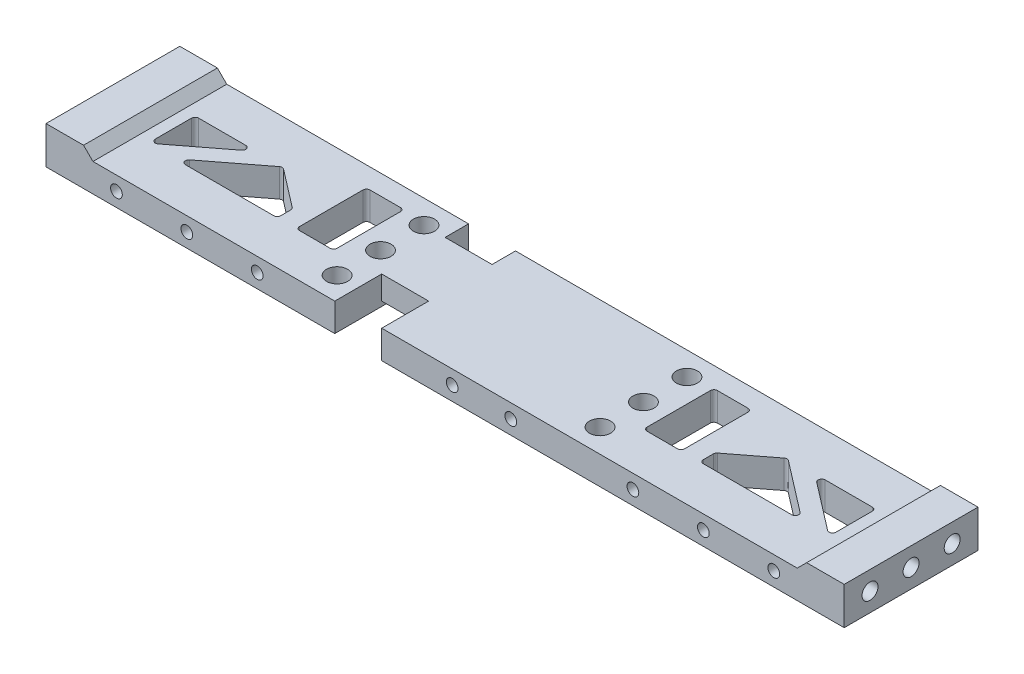
from build123d import *
from OCP.BRepFilletAPI import BRepFilletAPI_MakeChamfer

# Parameters (mm, degrees)
ESBO_O1_W                                           = 340
ESBO_O1_H                                           = 57
RESSALTO_EXTRUS_O1_DEPTH                            = 12
ESBO_O2_W                                           = 20
ESBO_O2_H                                           = 57
RESSALTO_EXTRUS_O2_DEPTH                            = 4
BROCA_DE_ROSQUEAR_PARA_TARRAXA_DE_M81_D             = 6.8
BROCA_DE_ROSQUEAR_PARA_TARRAXA_DE_M81_DEPTH         = 15
BROCA_DE_ROSQUEAR_PARA_TARRAXA_DE_M81_TIP           = 2.042926105
BROCA_DE_ROSQUEAR_PARA_TARRAXA_DE_M82_D             = 6.8
BROCA_DE_ROSQUEAR_PARA_TARRAXA_DE_M82_DEPTH         = 15
BROCA_DE_ROSQUEAR_PARA_TARRAXA_DE_M82_TIP           = 2.042926105
ESBO_O7_W                                           = 20
ESBO_O7_H                                           = 10
ESBO_O7_H_2                                         = 20
CORTE_EXTRUS_O1_DEPTH                               = 345.953620071
CHANFRO1_SIZE                                       = 2
CHANFRO1_SIZE2                                      = 3.464101615
CHANFRO3_SIZE                                       = 4
BROCA_DE_ROSQUEAR_PARA_TARRAXA_DE_M61_D             = 5
BROCA_DE_ROSQUEAR_PARA_TARRAXA_DE_M61_DEPTH         = 15
BROCA_DE_ROSQUEAR_PARA_TARRAXA_DE_M61_TIP           = 1.502151548
BROCA_DE_ROSQUEAR_PARA_TARRAXA_DE_M62_D             = 5
BROCA_DE_ROSQUEAR_PARA_TARRAXA_DE_M62_DEPTH         = 15
BROCA_DE_ROSQUEAR_PARA_TARRAXA_DE_M62_TIP           = 1.502151548
ESCAREADO_PARA_PARAFUSO_ALLEN_SEXTAVADO_D           = 9
ESCAREADO_PARA_PARAFUSO_ALLEN_SEXTAVADO_DEPTH       = 15
ESCAREADO_PARA_PARAFUSO_ALLEN_SEXTAVADO_CSINK_D     = 17.92
ESCAREADO_PARA_PARAFUSO_ALLEN_SEXTAVADO_CSINK_ANGLE = 90
ESCAREADO_PARA_PARAFUSO_ALLEN_SEXTAVADO_TIP         = 2.703872786
ESBO_O19_W                                          = 16
ESBO_O19_H                                          = 30
CORTE_EXTRUS_O3_DEPTH                               = 346.115922554
FILETE6_R                                           = 1.5


with BuildPart() as part:
    # Esboço1 → Ressalto-extrusão1 (new body)
    with BuildSketch(Plane(origin=(0, 0, 0), x_dir=(1, 0, 0), z_dir=(0, 1, 0))):
        with Locations((170, 28.5)):
            Rectangle(ESBO_O1_W, ESBO_O1_H)
    extrude(amount=RESSALTO_EXTRUS_O1_DEPTH)

    # Esboço2 → Ressalto-extrusão2 (add)
    with BuildSketch(Plane(origin=(0, 12, 0), x_dir=(1, 0, 0), z_dir=(0, 1, 0))):
        with Locations((10, 28.5)):
            Rectangle(ESBO_O2_W, ESBO_O2_H)
        with Locations((330, 28.5)):
            Rectangle(ESBO_O2_W, ESBO_O2_H)
    extrude(amount=RESSALTO_EXTRUS_O2_DEPTH)

    # Broca de rosquear para tarraxa de M81
    with Locations(Plane.ZY):
        with Locations((-46, 8), (-28.5, 8), (-11, 8)):
            Hole(BROCA_DE_ROSQUEAR_PARA_TARRAXA_DE_M81_D / 2, depth=BROCA_DE_ROSQUEAR_PARA_TARRAXA_DE_M81_DEPTH)
            with Locations((0, 0, -(BROCA_DE_ROSQUEAR_PARA_TARRAXA_DE_M81_DEPTH + BROCA_DE_ROSQUEAR_PARA_TARRAXA_DE_M81_TIP / 2))):  # 118° drill point
                Cone(0, BROCA_DE_ROSQUEAR_PARA_TARRAXA_DE_M81_D / 2, BROCA_DE_ROSQUEAR_PARA_TARRAXA_DE_M81_TIP, mode=Mode.SUBTRACT)

    # Broca de rosquear para tarraxa de M82
    with Locations(Plane(origin=(340, 0, 0), x_dir=(0, 0, -1), z_dir=(1, 0, 0))):
        with Locations((28.5, 8), (11, 8), (46, 8)):
            Hole(BROCA_DE_ROSQUEAR_PARA_TARRAXA_DE_M82_D / 2, depth=BROCA_DE_ROSQUEAR_PARA_TARRAXA_DE_M82_DEPTH)
            with Locations((0, 0, -(BROCA_DE_ROSQUEAR_PARA_TARRAXA_DE_M82_DEPTH + BROCA_DE_ROSQUEAR_PARA_TARRAXA_DE_M82_TIP / 2))):  # 118° drill point
                Cone(0, BROCA_DE_ROSQUEAR_PARA_TARRAXA_DE_M82_D / 2, BROCA_DE_ROSQUEAR_PARA_TARRAXA_DE_M82_TIP, mode=Mode.SUBTRACT)

    # Esboço7 → Corte-extrusão1 (cut, through all)
    with BuildSketch(Plane(origin=(0, 12, 0), x_dir=(1, 0, 0), z_dir=(0, 1, 0))):
        with Locations((133, 52)):
            Rectangle(ESBO_O7_W, ESBO_O7_H)
        with Locations((133, 10)):
            Rectangle(ESBO_O7_W, ESBO_O7_H_2)
    extrude(amount=-CORTE_EXTRUS_O1_DEPTH, mode=Mode.SUBTRACT)

    # Chanfro1: one chamfer whose edges measure the first distance from different faces: ONE call of the kernel's chamfer builder (chamfer() names one face for all edges)
    chanfro1_edges_1 = [part.edges().sort_by_distance(p)[0] for p in [
        (133, 0, -47),
    ]]
    chanfro1_side_1 = [part.faces().sort_by_distance(p)[0] for p in [
        (133, 6, -47),
    ]]
    chanfro1_edges_2 = [part.edges().sort_by_distance(p)[0] for p in [
        (133, 0, -20),
    ]]
    chanfro1_side_2 = [part.faces().sort_by_distance(p)[0] for p in [
        (133, 6, -20),
    ]]
    chanfro1 = BRepFilletAPI_MakeChamfer(part.part.solid().wrapped)
    for e in chanfro1_edges_1:
        chanfro1.Add(CHANFRO1_SIZE, CHANFRO1_SIZE2, e.wrapped, chanfro1_side_1[0].wrapped)  # the first distance lies on this face
    for e in chanfro1_edges_2:
        chanfro1.Add(CHANFRO1_SIZE, CHANFRO1_SIZE2, e.wrapped, chanfro1_side_2[0].wrapped)  # the first distance lies on this face
    add(Compound.cast(chanfro1.Shape()), mode=Mode.REPLACE)

    # Chanfro3
    chanfro3_edges = [part.edges().sort_by_distance(p)[0] for p in [
        (20, 16, -28.5),
        (320, 16, -28.5),
    ]]
    chamfer(chanfro3_edges, length=CHANFRO3_SIZE - 0.0001)  # a hair under: the kernel refuses the full size

    # Broca de rosquear para tarraxa de M61
    with Locations(Plane(origin=(0, 0, -57), x_dir=(-1, 0, 0), z_dir=(0, 0, -1))):
        with Locations((-310, 6), (-280, 6), (-30, 6), (-60, 6), (-264, 6), (-76, 6), (-198, 6), (-173, 6)):
            Hole(BROCA_DE_ROSQUEAR_PARA_TARRAXA_DE_M61_D / 2, depth=BROCA_DE_ROSQUEAR_PARA_TARRAXA_DE_M61_DEPTH)
            with Locations((0, 0, -(BROCA_DE_ROSQUEAR_PARA_TARRAXA_DE_M61_DEPTH + BROCA_DE_ROSQUEAR_PARA_TARRAXA_DE_M61_TIP / 2))):  # 118° drill point
                Cone(0, BROCA_DE_ROSQUEAR_PARA_TARRAXA_DE_M61_D / 2, BROCA_DE_ROSQUEAR_PARA_TARRAXA_DE_M61_TIP, mode=Mode.SUBTRACT)

    # Broca de rosquear para tarraxa de M62
    with Locations(Plane.XY):
        with Locations((30, 6), (60, 6), (280, 6), (310, 6), (90, 6), (250, 6), (173, 6), (198, 6)):
            Hole(BROCA_DE_ROSQUEAR_PARA_TARRAXA_DE_M62_D / 2, depth=BROCA_DE_ROSQUEAR_PARA_TARRAXA_DE_M62_DEPTH)
            with Locations((0, 0, -(BROCA_DE_ROSQUEAR_PARA_TARRAXA_DE_M62_DEPTH + BROCA_DE_ROSQUEAR_PARA_TARRAXA_DE_M62_TIP / 2))):  # 118° drill point
                Cone(0, BROCA_DE_ROSQUEAR_PARA_TARRAXA_DE_M62_D / 2, BROCA_DE_ROSQUEAR_PARA_TARRAXA_DE_M62_TIP, mode=Mode.SUBTRACT)

    # Escareado para parafuso Allen sextavado escareado de M82
    with Locations(Plane(origin=(0, 0, 0), x_dir=(-1, 0, 0), z_dir=(0, -1, 0))):
        with Locations((-114, 47), (-114, 28.5), (-114, 10), (-226, 47), (-226, 28.5), (-226, 10)):
            CounterSinkHole(ESCAREADO_PARA_PARAFUSO_ALLEN_SEXTAVADO_D / 2, ESCAREADO_PARA_PARAFUSO_ALLEN_SEXTAVADO_CSINK_D / 2, depth=ESCAREADO_PARA_PARAFUSO_ALLEN_SEXTAVADO_DEPTH, counter_sink_angle=ESCAREADO_PARA_PARAFUSO_ALLEN_SEXTAVADO_CSINK_ANGLE)
            with Locations((0, 0, -(ESCAREADO_PARA_PARAFUSO_ALLEN_SEXTAVADO_DEPTH + ESCAREADO_PARA_PARAFUSO_ALLEN_SEXTAVADO_TIP / 2))):  # 118° drill point
                Cone(0, ESCAREADO_PARA_PARAFUSO_ALLEN_SEXTAVADO_D / 2, ESCAREADO_PARA_PARAFUSO_ALLEN_SEXTAVADO_TIP, mode=Mode.SUBTRACT)

    # Esboço19 → Corte-extrusão3 (cut, through all)
    with BuildSketch(Plane.XZ):
        Polygon((25, -18.5), (25, -38.5), (51, -38.5), align=None)
        Polygon((36.480853627, -18.5), (62.480853627, -38.5), (80, -25.023733559), (80, -18.5), (62.480853627, -18.5), align=None)
        with Locations((96, -33.5)):
            Rectangle(ESBO_O19_W, ESBO_O19_H)
        with Locations((244, -33.5)):
            Rectangle(ESBO_O19_W, ESBO_O19_H)
        Polygon((260, -25.023733559), (260, -18.5), (277.519146373, -18.5), (303.519146373, -18.5), (277.519146373, -38.5), align=None)
        Polygon((315, -38.5), (289, -38.5), (315, -18.5), align=None)
    extrude(amount=-CORTE_EXTRUS_O3_DEPTH, mode=Mode.SUBTRACT)

    # Filete6
    filete6_edges = [part.edges().sort_by_distance(p)[0] for p in [
        (36.480853627, 6, -18.5),
        (80, 6, -18.5),
        (80, 6, -25.023733559),
        (62.480853627, 6, -38.5),
        (104, 6, -48.5),
        (88, 6, -48.5),
        (88, 6, -18.5),
        (104, 6, -18.5),
        (252, 6, -18.5),
        (252, 6, -48.5),
        (236, 6, -48.5),
        (236, 6, -18.5),
        (277.519146373, 6, -38.5),
        (260, 6, -25.023733559),
        (260, 6, -18.5),
        (303.519146373, 6, -18.5),
        (315, 6, -18.5),
        (315, 6, -38.5),
        (289, 6, -38.5),
        (25, 6, -18.5),
        (51, 6, -38.5),
        (25, 6, -38.5),
    ]]
    fillet(filete6_edges, radius=FILETE6_R)


solid = part.part
